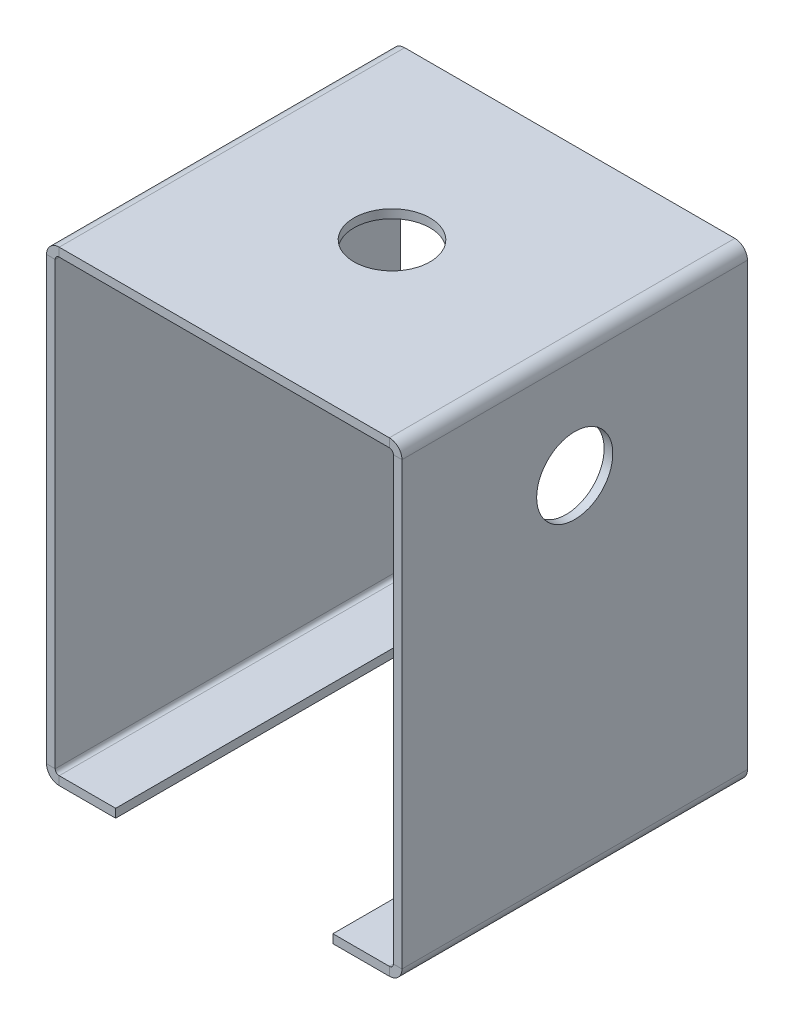
from build123d import *

# Parameters (mm, degrees)
SKETCH2_W                    = 1.5875
SKETCH2_H                    = 82.55
BASE_FLANGE1_DEPTH           = 63.5
EDGE_FLANGE1_STRIP_W         = 7.8232
EDGE_FLANGE1_STRIP_H         = 1.5875
EDGE_FLANGE1_STRIP_CUT_DEPTH = 63.5
EDGE_FLANGE1_DEPTH           = 63.5
SKETCH10_R                   = 7
CUT_EXTRUDE1_DEPTH           = 105.73891424
EDGE_FLANGE2_STRIP_W         = 7.8232
EDGE_FLANGE2_STRIP_H         = 1.5875
EDGE_FLANGE2_STRIP_CUT_DEPTH = 63.5
EDGE_FLANGE2_DEPTH           = 63.5
EDGE_FLANGE3_STRIP_W         = 7.8232
EDGE_FLANGE3_STRIP_H         = 1.5875
EDGE_FLANGE3_STRIP_CUT_DEPTH = 63.5
EDGE_FLANGE3_DEPTH           = 63.5
EDGE_FLANGE4_STRIP_W         = 7.8232
EDGE_FLANGE4_STRIP_H         = 1.5875
EDGE_FLANGE4_STRIP_CUT_DEPTH = 63.5
EDGE_FLANGE4_DEPTH           = 63.5
SKETCH20_R                   = 7
CUT_EXTRUDE2_DEPTH           = 125.278268888


# Sheet-metal steps are written as plain solids
with BuildPart() as part:
    # Sketch2 → Base-Flange1 (new body)
    with BuildSketch(Plane.XY):
        with Locations((0.79375, 41.275)):
            Rectangle(SKETCH2_W, SKETCH2_H)
    extrude(amount=BASE_FLANGE1_DEPTH)

    # Edge-Flange1 strip (across the edge) → Edge-Flange1 strip cut (cut)
    with BuildSketch(Plane(origin=(0, 0, 0), x_dir=(0, 1, 0), z_dir=(0, 0, 1))):
        with Locations((-3.175, -0.79375)):
            Rectangle(EDGE_FLANGE1_STRIP_W, EDGE_FLANGE1_STRIP_H)
    extrude(amount=EDGE_FLANGE1_STRIP_CUT_DEPTH, mode=Mode.SUBTRACT)

    # Edge-Flange1 section (across the edge) → Edge-Flange1 (add)
    with BuildSketch(Plane(origin=(0, 0, 0), x_dir=(0, 1, 0), z_dir=(0, 0, 1))):
        with BuildLine():
            Line((-1.5875, 0.7366), (-1.5875, 11.1125))
            Line((-1.5875, 11.1125), (0, 11.1125))
            Line((0, 11.1125), (0, 0.7366))
            ThreePointArc((0, 0.7366), (0.215745145, 0.215745145), (0.7366, 0))
            Line((0.7366, 0), (0.7366, -1.5875))
            ThreePointArc((0.7366, -1.5875), (-0.90678687, -0.90678687), (-1.5875, 0.7366))
        make_face()
    extrude(amount=EDGE_FLANGE1_DEPTH)

    # Sketch10 → Cut-Extrude1 (cut, through all)
    with BuildSketch(Plane.ZY):
        with Locations((31.75, 63.4125)):
            Circle(SKETCH10_R)
    extrude(amount=-CUT_EXTRUDE1_DEPTH, mode=Mode.SUBTRACT)

    # Edge-Flange2 strip (across the edge) → Edge-Flange2 strip cut (cut)
    with BuildSketch(Plane(origin=(0, 82.55, 63.5), x_dir=(0, -1, 0), z_dir=(0, 0, -1))):
        with Locations((-3.175, -0.79375)):
            Rectangle(EDGE_FLANGE2_STRIP_W, EDGE_FLANGE2_STRIP_H)
    extrude(amount=EDGE_FLANGE2_STRIP_CUT_DEPTH, mode=Mode.SUBTRACT)

    # Edge-Flange2 section (across the edge) → Edge-Flange2 (add)
    with BuildSketch(Plane(origin=(0, 82.55, 63.5), x_dir=(0, -1, 0), z_dir=(0, 0, -1))):
        with BuildLine():
            Line((-1.5875, 0.7366), (-1.5875, 62.162499944))
            Line((-1.5875, 62.162499944), (0, 62.162499944))
            Line((0, 62.162499944), (0, 0.7366))
            ThreePointArc((0, 0.7366), (0.215745145, 0.215745145), (0.7366, 0))
            Line((0.7366, 0), (0.7366, -1.5875))
            ThreePointArc((0.7366, -1.5875), (-0.90678687, -0.90678687), (-1.5875, 0.7366))
        make_face()
    extrude(amount=EDGE_FLANGE2_DEPTH)

    # Edge-Flange3 strip (across the edge) → Edge-Flange3 strip cut (cut)
    with BuildSketch(Plane(origin=(-62.162499944, 82.55, 63.5), x_dir=(1, 0, 0), z_dir=(0, 0, -1))):
        with Locations((-3.175, -0.79375)):
            Rectangle(EDGE_FLANGE3_STRIP_W, EDGE_FLANGE3_STRIP_H)
    extrude(amount=EDGE_FLANGE3_STRIP_CUT_DEPTH, mode=Mode.SUBTRACT)

    # Edge-Flange3 section (across the edge) → Edge-Flange3 (add)
    with BuildSketch(Plane(origin=(-62.162499944, 82.55, 63.5), x_dir=(1, 0, 0), z_dir=(0, 0, -1))):
        with BuildLine():
            Line((-1.5875, 0.7366), (-1.5875, 82.55))
            Line((-1.5875, 82.55), (0, 82.55))
            Line((0, 82.55), (0, 0.7366))
            ThreePointArc((0, 0.7366), (0.215745145, 0.215745145), (0.7366, 0))
            Line((0.7366, 0), (0.7366, -1.5875))
            ThreePointArc((0.7366, -1.5875), (-0.90678687, -0.90678687), (-1.5875, 0.7366))
        make_face()
    extrude(amount=EDGE_FLANGE3_DEPTH)

    # Edge-Flange4 strip (across the edge) → Edge-Flange4 strip cut (cut)
    with BuildSketch(Plane(origin=(-62.162499944, 0, 63.5), x_dir=(0, 1, 0), z_dir=(0, 0, -1))):
        with Locations((-3.175, -0.79375)):
            Rectangle(EDGE_FLANGE4_STRIP_W, EDGE_FLANGE4_STRIP_H)
    extrude(amount=EDGE_FLANGE4_STRIP_CUT_DEPTH, mode=Mode.SUBTRACT)

    # Edge-Flange4 section (across the edge) → Edge-Flange4 (add)
    with BuildSketch(Plane(origin=(-62.162499944, 0, 63.5), x_dir=(0, 1, 0), z_dir=(0, 0, -1))):
        with BuildLine():
            Line((-1.5875, 0.7366), (-1.5875, 11.1125))
            Line((-1.5875, 11.1125), (0, 11.1125))
            Line((0, 11.1125), (0, 0.7366))
            ThreePointArc((0, 0.7366), (0.215745145, 0.215745145), (0.7366, 0))
            Line((0.7366, 0), (0.7366, -1.5875))
            ThreePointArc((0.7366, -1.5875), (-0.90678687, -0.90678687), (-1.5875, 0.7366))
        make_face()
    extrude(amount=EDGE_FLANGE4_DEPTH)

    # Sketch20 → Cut-Extrude2 (cut, through all)
    with BuildSketch(Plane(origin=(0, 84.1375, 0), x_dir=(1, 0, 0), z_dir=(0, 1, 0))):
        with Locations(Location((-32, -31.75, 0), (0, 0, 180))):
            Circle(SKETCH20_R)
    extrude(amount=-CUT_EXTRUDE2_DEPTH, mode=Mode.SUBTRACT)


solid = part.part
